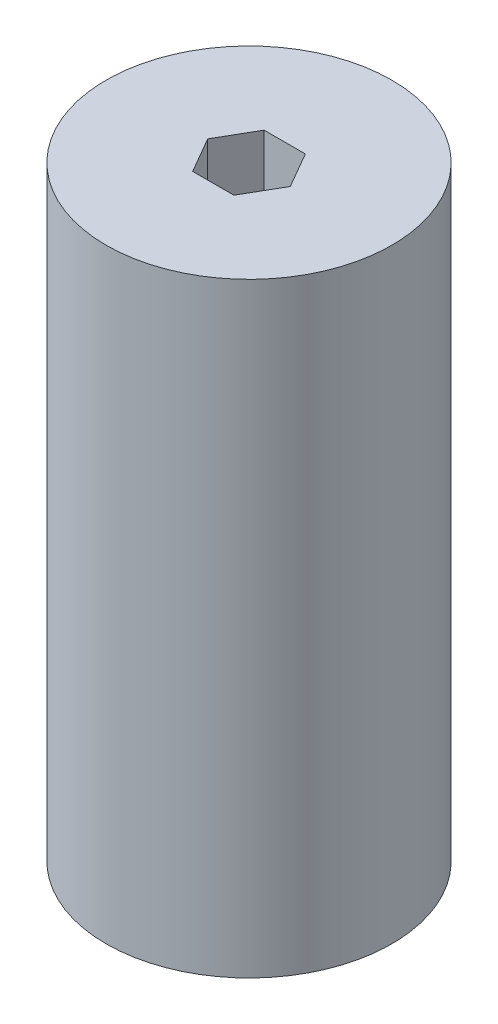
from build123d import *

# Parameters (mm, degrees)
SKETCH1_R           = 30
BOSS_EXTRUDE1_DEPTH = 127


with BuildPart() as part:
    # Sketch1 → Boss-Extrude1 (new body)
    with BuildSketch(Plane(origin=(0, 0, 0), x_dir=(1, 0, 0), z_dir=(0, 1, 0))):
        Circle(SKETCH1_R)
        Polygon((8.660254038, 0), (4.330127019, 7.5), (-4.330127019, 7.5), (-8.660254038, 0), (-4.330127019, -7.5), (4.330127019, -7.5), align=None, mode=Mode.SUBTRACT)
    extrude(amount=BOSS_EXTRUDE1_DEPTH)


solid = part.part
